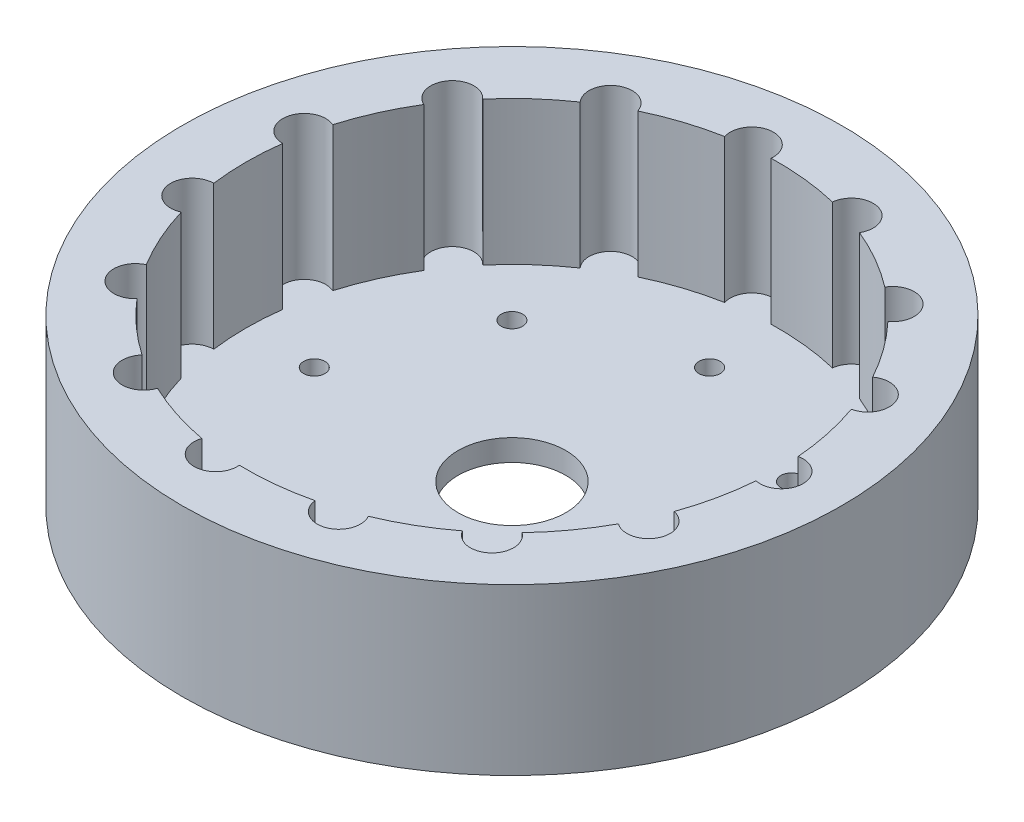
from build123d import *

# Parameters (mm, degrees)
SKETCH1_R           = 45.85
SKETCH1_R_2         = 7.5
BOSS_EXTRUDE1_DEPTH = 3
SKETCH1_6_R         = 1.48
CUT_EXTRUDE1_DEPTH  = 2.22
BOSS_EXTRUDE2_START = 20
SKETCH1_7_R         = 45.85
BOSS_EXTRUDE2_DEPTH = 20


with BuildPart() as part:
    # Sketch1 → Boss-Extrude1 (new body)
    with BuildSketch(Plane(origin=(0, 0, 0), x_dir=(1, 0, 0), z_dir=(0, 1, 0))):
        Circle(SKETCH1_R)
        Circle(SKETCH1_R_2, mode=Mode.SUBTRACT)
    extrude(amount=-BOSS_EXTRUDE1_DEPTH)

    # Sketch1<6> → Cut-Extrude1 (cut)
    with BuildSketch(Plane(origin=(0, 0, 0), x_dir=(1, 0, 0), z_dir=(0, 1, 0))):
        with Locations((27.5, 0)):
            Circle(SKETCH1_6_R)
        with Locations((19.445436483, -19.445436483)):
            Circle(SKETCH1_6_R)
        with Locations((0, -27.5)):
            Circle(SKETCH1_6_R)
        with Locations((-19.445436483, -19.445436483)):
            Circle(SKETCH1_6_R)
        with Locations((-27.5, 0)):
            Circle(SKETCH1_6_R)
        with Locations((-19.445436483, 19.445436483)):
            Circle(SKETCH1_6_R)
        with Locations((0, 27.5)):
            Circle(SKETCH1_6_R)
        with Locations((19.445436483, 19.445436483)):
            Circle(SKETCH1_6_R)
    extrude(amount=-CUT_EXTRUDE1_DEPTH, mode=Mode.SUBTRACT)

    # Sketch1<7> → Boss-Extrude2 (add)
    with BuildSketch(Plane(origin=(0, 0, 0), x_dir=(1, 0, 0), z_dir=(0, 1, 0)).offset(BOSS_EXTRUDE2_START)):
        Circle(SKETCH1_7_R)
        with BuildLine():
            ThreePointArc((36.883333333, 2.935936345), (39.39076704, 2.32916294), (40.5, 0))
            ThreePointArc((40.5, 0), (39.39076704, -2.32916294), (36.883333333, -2.935936345))
            ThreePointArc((36.883333333, -2.935936345), (36.191461227, -7.69273256), (34.888754523, -12.319691873))
            ThreePointArc((34.888754523, -12.319691873), (36.59166411, -13.367471546), (37.257954662, -15.252624115))
            ThreePointArc((37.257954662, -15.252624115), (35.6231437, -17.924001829), (32.500448736, -17.683914497))
            ThreePointArc((32.500448736, -17.683914497), (29.933628792, -21.748054335), (26.861593101, -25.445133446))
            ThreePointArc((26.861593101, -25.445133446), (27.767055295, -26.50917897), (28.092397738, -27.867930955))
            ThreePointArc((28.092397738, -27.867930955), (25.872343464, -30.764771418), (22.497941295, -29.37418318))
            ThreePointArc((22.497941295, -29.37418318), (18.5, -32.04293994), (14.189818202, -34.170880284))
            ThreePointArc((14.189818202, -34.170880284), (14.486847583, -34.891651942), (14.588137289, -35.664619361))
            ThreePointArc((14.588137289, -35.664619361), (11.748752331, -38.660316744), (8.605335417, -35.985388734))
            ThreePointArc((8.605335417, -35.985388734), (3.867553141, -36.797310129), (-0.935505175, -36.988171489))
            ThreePointArc((-0.935505175, -36.988171489), (-0.92374189, -37.141170608), (-0.919817373, -37.294571076))
            ThreePointArc((-0.919817373, -37.294571076), (-4.385552663, -40.258199029), (-6.775211132, -36.37439366))
            ThreePointArc((-6.775211132, -36.37439366), (-11.433628792, -35.189091103), (-15.899071208, -33.409871815))
            ThreePointArc((-15.899071208, -33.409871815), (-20.25, -35.074028853), (-20.984262125, -30.47393547))
            ThreePointArc((-20.984262125, -30.47393547), (-24.757832435, -27.496358543), (-28.113543391, -24.054701786))
            ThreePointArc((-28.113543391, -24.054701786), (-32.765188272, -23.805302718), (-31.564943561, -19.304256991))
            ThreePointArc((-31.564943561, -19.304256991), (-33.801181933, -15.049255794), (-35.466928517, -10.540255288))
            ThreePointArc((-35.466928517, -10.540255288), (-39.61497783, -8.420423478), (-36.687759497, -4.796697105))
            ThreePointArc((-36.687759497, -4.796697105), (-37, 0), (-36.687759497, 4.796697105))
            ThreePointArc((-36.687759497, 4.796697105), (-39.61497783, 8.420423478), (-35.466928517, 10.540255288))
            ThreePointArc((-35.466928517, 10.540255288), (-33.801181933, 15.049255794), (-31.564943561, 19.304256991))
            ThreePointArc((-31.564943561, 19.304256991), (-32.765188272, 23.805302718), (-28.113543391, 24.054701786))
            ThreePointArc((-28.113543391, 24.054701786), (-24.757832435, 27.496358543), (-20.984262125, 30.47393547))
            ThreePointArc((-20.984262125, 30.47393547), (-20.25, 35.074028853), (-15.899071208, 33.409871815))
            ThreePointArc((-15.899071208, 33.409871815), (-11.433628792, 35.189091103), (-6.775211132, 36.37439366))
            ThreePointArc((-6.775211132, 36.37439366), (-4.385552663, 40.258199029), (-0.919817373, 37.294571076))
            ThreePointArc((-0.919817373, 37.294571076), (-0.92374189, 37.141170608), (-0.935505175, 36.988171489))
            ThreePointArc((-0.935505175, 36.988171489), (3.867553141, 36.797310129), (8.605335417, 35.985388734))
            ThreePointArc((8.605335417, 35.985388734), (11.748752331, 38.660316744), (14.588137289, 35.664619361))
            ThreePointArc((14.588137289, 35.664619361), (14.486847583, 34.891651942), (14.189818202, 34.170880284))
            ThreePointArc((14.189818202, 34.170880284), (18.5, 32.04293994), (22.497941295, 29.37418318))
            ThreePointArc((22.497941295, 29.37418318), (25.872343464, 30.764771418), (28.092397738, 27.867930955))
            ThreePointArc((28.092397738, 27.867930955), (27.767055295, 26.50917897), (26.861593101, 25.445133446))
            ThreePointArc((26.861593101, 25.445133446), (29.933628792, 21.748054335), (32.500448736, 17.683914497))
            ThreePointArc((32.500448736, 17.683914497), (35.6231437, 17.924001829), (37.257954662, 15.252624115))
            ThreePointArc((37.257954662, 15.252624115), (36.59166411, 13.367471546), (34.888754523, 12.319691873))
            ThreePointArc((34.888754523, 12.319691873), (36.191461227, 7.69273256), (36.883333333, 2.935936345))
        make_face(mode=Mode.SUBTRACT)
    extrude(amount=-BOSS_EXTRUDE2_DEPTH)


solid = part.part
